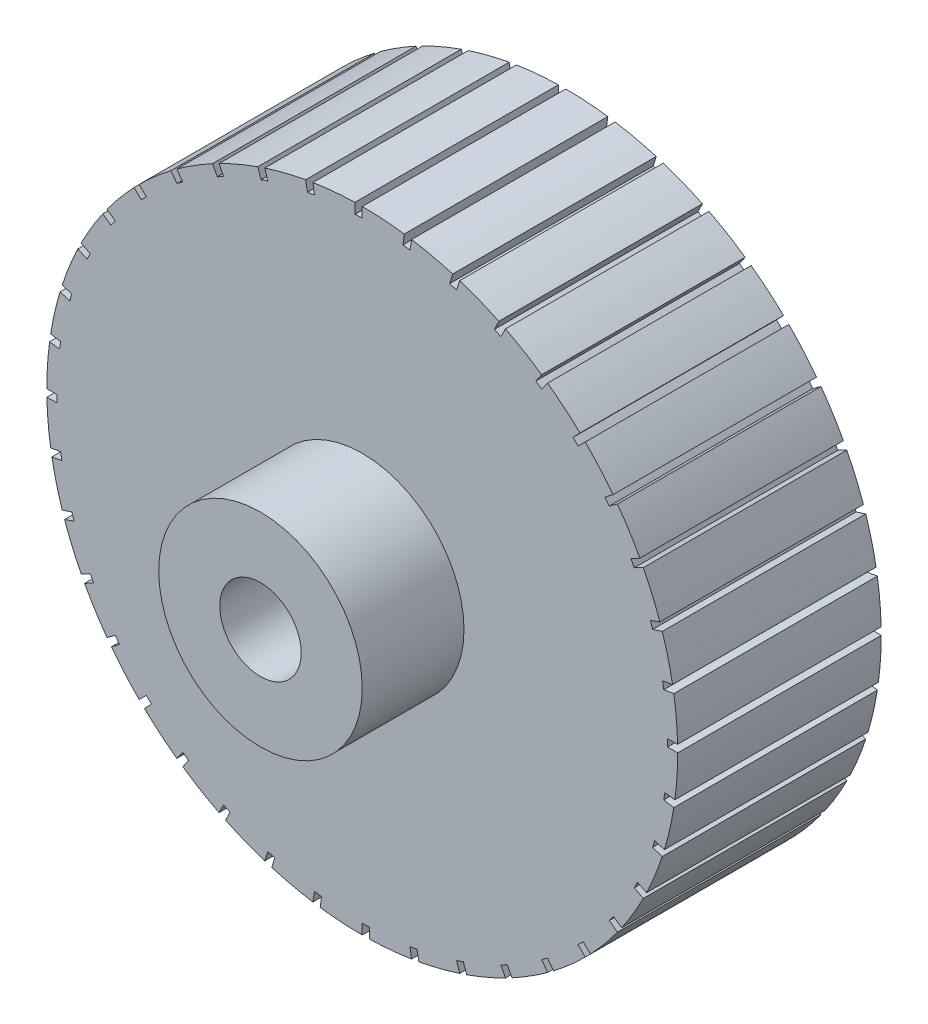
from build123d import *

# Parameters (mm, degrees)
ESQUISSE1_R                  = 15
ESQUISSE1_R_2                = 2
BOSS_EXTRU_1_DEPTH           = 10
ESQUISSE2_R                  = 5
ESQUISSE2_R_2                = 2
BOSS_EXTRU_2_DEPTH           = 5
BALAYAGE1_DEPTH              = 10
R_P_TITION_CIRCULAIRE1_COUNT = 40


# Read off the part's stored shape, not the designer's step: Balayage1
with BuildPart() as part:
    # Esquisse1 → Boss.-Extru.1 (new body)
    with BuildSketch(Plane.XY):
        Circle(ESQUISSE1_R)
        Circle(ESQUISSE1_R_2, mode=Mode.SUBTRACT)
    extrude(amount=BOSS_EXTRU_1_DEPTH)

    # Esquisse2 → Boss.-Extru.2 (add)
    with BuildSketch(Plane.XY.offset(10)):
        Circle(ESQUISSE2_R)
        Circle(ESQUISSE2_R_2, mode=Mode.SUBTRACT)
    extrude(amount=BOSS_EXTRU_2_DEPTH)

    # Balayage1 outline → Balayage1 (add)
    with BuildSketch(Plane.XY):
        with BuildLine():
            Line((2, 14.866068747), (2.066666667, 15.361604372))
            ThreePointArc((2.066666667, 15.361604372), (1.035647679, 15.465362391), (0, 15.5))
            Line((0, 15.5), (0, 15))
            ThreePointArc((0, 15), (1.002239689, 14.966479733), (2, 14.866068747))
        make_face()
    balayage1 = extrude(amount=BALAYAGE1_DEPTH)

    # Répétition circulaire1: Balayage1 ×40 about axis
    r_p_tition_circulaire1_axis = Axis((0, 0, 0), (0, 0, 1))
    for i in range(1, R_P_TITION_CIRCULAIRE1_COUNT):
        add(balayage1.rotate(r_p_tition_circulaire1_axis, i * 360 / R_P_TITION_CIRCULAIRE1_COUNT))


solid = part.part
